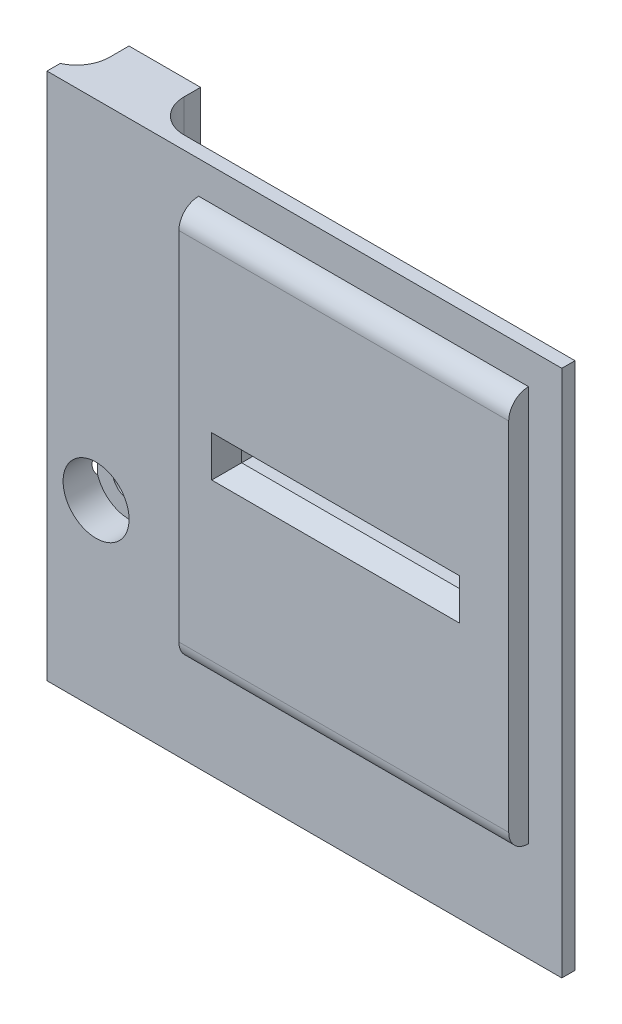
from build123d import *

# Parameters (mm, degrees)
SKETCH1_W           = 78
SKETCH1_H           = 80
BOSS_EXTRUDE1_DEPTH = 2
SKETCH2_W           = 34.450546123
SKETCH2_H           = 3.156291742
CUT_EXTRUDE1_DEPTH  = 10
SKETCH3_W           = 10.842335807
SKETCH3_H           = 80
BOSS_EXTRUDE2_DEPTH = 7.5
SKETCH4_R           = 2.5
CUT_EXTRUDE2_DEPTH  = 20
SKETCH5_R           = 5
CUT_EXTRUDE3_DEPTH  = 5
FILLET1_R           = 5
SKETCH8_W           = 49.971339188
SKETCH8_H           = 59.988397901
BOSS_EXTRUDE3_DEPTH = 3
FILLET3_R           = 3
SKETCH9_W           = 34.450546123
SKETCH9_H           = 3.156291742
CUT_EXTRUDE4_DEPTH  = 3
CUT_EXTRUDE4_DRAFT  = 27


# Some blends are built 0.0001 mm under size
with BuildPart() as part:
    # Sketch1 → Boss-Extrude1 (new body)
    with BuildSketch(Plane.XY):
        with Locations((-26.054678924, 10.907965965)):
            Rectangle(SKETCH1_W, SKETCH1_H)
    extrude(amount=BOSS_EXTRUDE1_DEPTH)

    # Sketch2 → Cut-Extrude1 (cut)
    with BuildSketch(Plane(origin=(0, 0, 0), x_dir=(-1, 0, 0), z_dir=(0, 0, -1))):
        with Locations((18.339951986, 15.829820094)):
            Rectangle(SKETCH2_W, SKETCH2_H)
    extrude(amount=-CUT_EXTRUDE1_DEPTH, mode=Mode.SUBTRACT)

    # Sketch3 → Boss-Extrude2 (add)
    with BuildSketch(Plane(origin=(0, 0, 0), x_dir=(-1, 0, 0), z_dir=(0, 0, -1))):
        with Locations((56.706233252, 10.907965965)):
            Rectangle(SKETCH3_W, SKETCH3_H)
    extrude(amount=BOSS_EXTRUDE2_DEPTH)

    # Sketch4 → Cut-Extrude2 (cut)
    with BuildSketch(Plane(origin=(0, 0, -7.5), x_dir=(-1, 0, 0), z_dir=(0, 0, -1))):
        with Locations((57.617298924, -1.683561388)):
            Circle(SKETCH4_R)
    extrude(amount=-CUT_EXTRUDE2_DEPTH, mode=Mode.SUBTRACT)

    # Sketch5 → Cut-Extrude3 (cut)
    with BuildSketch(Plane.XY.offset(2)):
        with Locations((-57.617298924, -1.683561388)):
            Circle(SKETCH5_R)
    extrude(amount=-CUT_EXTRUDE3_DEPTH, mode=Mode.SUBTRACT)

    # Fillet1
    # the kernel refuses this fillet: 5 mm, written as the material it adds along each edge
    with BuildSketch(Plane(origin=(-51.285065348, 50.907965965, 0), x_dir=(1, 0, 0), z_dir=(0, -1, 0))) as fillet1_piece_1:
        with BuildLine():
            CenterArc((FILLET1_R, -FILLET1_R), FILLET1_R, 90, 90)
            Line((0, -FILLET1_R), (0, 0))
            Line((0, 0), (FILLET1_R, 0))
        make_face()
    extrude(amount=80)
    # the kernel refuses this fillet: 5 mm, written as the material it adds along each edge
    with BuildSketch(Plane(origin=(-62.127401155, -29.092034035, 0), x_dir=(0, 0, -1), z_dir=(0, 1, 0))) as fillet1_2_piece_1_section:
        with BuildLine():
            CenterArc((4.550145333, 5), FILLET1_R, 204.490631369, 65.509368631)
            Line((0, 2.927277769), (0, 0))
            Line((0, 0), (4.550145333, 0))
        make_face()
    fillet1_2_piece_1 = extrude(amount=36.625369426, mode=Mode.PRIVATE)
    fillet1_2_piece_1 = split(fillet1_2_piece_1, bisect_by=Plane(origin=(-62.127401155, -29.092034035, -3), z_dir=(0, 0, -1)), keep=Keep.TOP, mode=Mode.PRIVATE)
    add(fillet1_2_piece_1)
    with BuildSketch(Plane(origin=(-62.127401155, -29.092034035, 0), x_dir=(0, 0, -1), z_dir=(0, 1, 0))) as fillet1_2_piece_2_section:
        with BuildLine():
            CenterArc((4.550145333, 5), FILLET1_R, 204.490631369, 65.509368631)
            Line((0, 2.927277769), (0, 0))
            Line((0, 0), (4.550145333, 0))
        make_face()
    fillet1_2_piece_2 = extrude(amount=36.625369426, mode=Mode.PRIVATE)
    fillet1_2_piece_2 = fillet1_2_piece_2 - Plane(origin=(-57.617298924, -1.683561388, 0), x_dir=(1, 0, 0), z_dir=(0, 0, 1)) * Cylinder(5, 92, mode=Mode.PRIVATE)
    add(fillet1_2_piece_2)
    # the kernel refuses this fillet: 5 mm, written as the material it adds along each edge
    with BuildSketch(Plane(origin=(-62.127401155, 7.533335391, 0), x_dir=(-1, 0, 0), z_dir=(0, 1, 0))) as fillet1_3_piece_1:
        with BuildLine():
            CenterArc((5, -4.550145333), FILLET1_R, 114.490631369, 65.509368631)
            Line((0, -4.550145333), (0, 0))
            Line((0, 0), (2.927277769, 0))
        make_face()
    extrude(amount=43.374630574)
    # the kernel refuses this fillet: 5 mm, written as the material it takes off along each edge

    # Sketch8 → Boss-Extrude3 (add)
    with BuildSketch(Plane.XY.offset(2)):
        with Locations((-17.086726302, 15.98380471)):
            Rectangle(SKETCH8_W, SKETCH8_H)
    extrude(amount=BOSS_EXTRUDE3_DEPTH)

    # Fillet3
    fillet3_edges = [part.edges().sort_by_distance(p)[0] for p in [
        (-17.086726302, -14.010394241, 5),
        (-17.086726302, 45.97800366, 5),
    ]]
    fillet(fillet3_edges, radius=FILLET3_R - 0.0001)  # a hair under: the kernel refuses the full size


with BuildPart() as cut_extrude4_tool:
    # Sketch9 → Cut-Extrude4 (with draft: the straight prism first)
    with BuildSketch(Plane(origin=(0, 0, 2), x_dir=(-1, 0, 0), z_dir=(0, 0, -1))):
        with Locations((18.339951986, 15.829820094)):
            Rectangle(SKETCH9_W, SKETCH9_H)
    extrude(amount=-CUT_EXTRUDE4_DEPTH)
    # Cut-Extrude4: the draft: its side faces are tilted about the plane it starts from
    cut_extrude4_sides = [cut_extrude4_tool.faces().sort_by_distance(p)[0] for p in [
        (-18.339951986, 17.407965965, 3.5),
        (-1.114678924, 15.829820094, 3.5),
        (-18.339951986, 14.251674223, 3.5),
        (-35.565225047, 15.829820094, 3.5),
    ]]
    draft(cut_extrude4_sides, Plane(origin=(0, 0, 2), x_dir=(-1, 0, 0), z_dir=(0, 0, -1)), CUT_EXTRUDE4_DRAFT)


with BuildPart() as part_1:
    add(part.part)

    # Cut-Extrude4: cut by cut_extrude4_tool
    add(cut_extrude4_tool.part, mode=Mode.SUBTRACT)


solid = part_1.part
